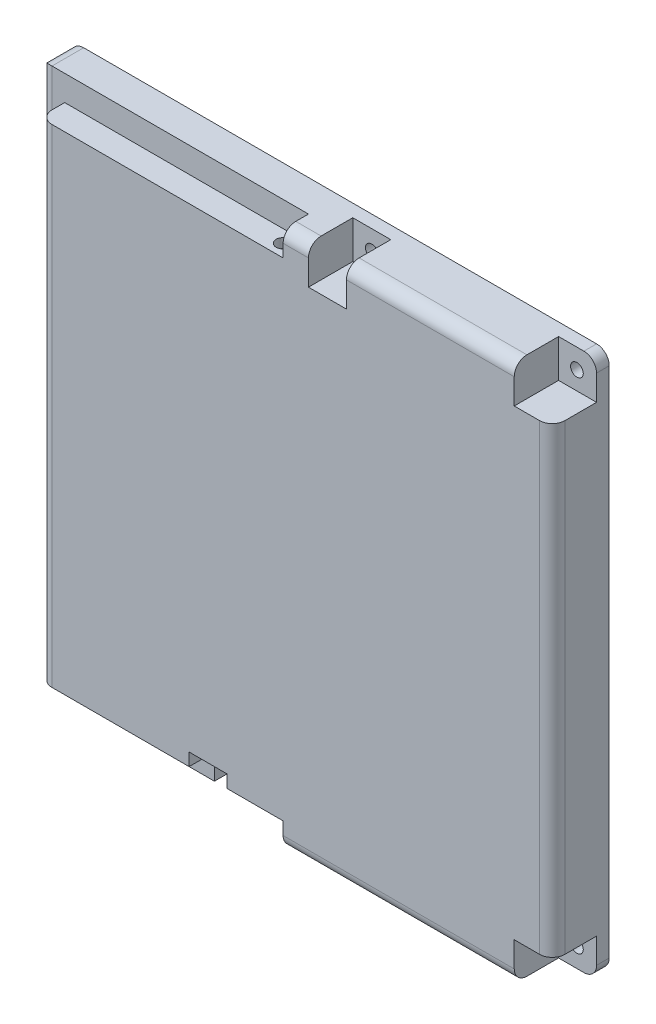
from build123d import *

# Parameters (mm, degrees)
EXTRUDE_1_DEPTH     = 9
CUT_EXTRUDE_2_DEPTH = 4
SKETCH_7_W          = 6
SKETCH_7_H          = 6
CUT_EXTRUDE_4_DEPTH = 7
SKETCH_10_W         = 6
SKETCH_10_H         = 6
CUT_EXTRUDE_6_DEPTH = 7
SHELL_1_T           = -1.5
SKETCH_5_R          = 1.1
CUT_EXTRUDE_3_DEPTH = 4
CUT_EXTRUDE_5_REACH = 179.286
CUT_EXTRUDE_START   = -7
SKETCH_6_R          = 1
FILLET_1_R          = 2
CUT_EXTRUDE_7_REACH = 172.192
SKETCH_12_R         = 1


with BuildPart() as part:
    # 草图1 → 凸台-拉伸1 (new body)
    with BuildSketch(Plane.XY):
        Polygon((70.444808084, 16.058078986), (70.444808084, -68.941921014), (155.445322416, -68.941921014), (155.444808084, 16.058078986), align=None)
    extrude(amount=EXTRUDE_1_DEPTH)

    # 草图4 → 支架切除-拉伸2 (cut)
    with BuildSketch(Plane.XY.offset(9)):
        Polygon((112.94506525, 16.058078986), (70.444808084, 16.058078986), (70.444808084, -68.941921014), (112.94506525, -68.941921014), (112.94506525, -64.941921014), (74.444808084, -64.941921014), (74.444808084, 12.058078986), (112.94506525, 12.058078986), align=None)
    extrude(amount=-CUT_EXTRUDE_2_DEPTH, mode=Mode.SUBTRACT)

    # 草图7 → 顶螺丝切除-拉伸4 (cut)
    with BuildSketch(Plane.XY.offset(9)):
        with Locations((152.445322416, 13.058078986)):
            Rectangle(SKETCH_7_W, SKETCH_7_H)
        with Locations((152.445322416, -65.941921014)):
            Rectangle(SKETCH_7_W, SKETCH_7_H)
    extrude(amount=-CUT_EXTRUDE_4_DEPTH, mode=Mode.SUBTRACT)

    # 草图10 → 底螺丝切除-拉伸6 (cut)
    with BuildSketch(Plane.XY.offset(9)):
        with Locations((119.944808084, 13.058078986)):
            Rectangle(SKETCH_10_W, SKETCH_10_H)
        with Locations((101.094808084, -65.941921014)):
            Rectangle(SKETCH_10_W, SKETCH_10_H)
    extrude(amount=-CUT_EXTRUDE_6_DEPTH, mode=Mode.SUBTRACT)

    # 抽壳1
    shell_1_openings = [part.faces().sort_by_distance(p)[0] for p in [
        (112.944936668, -26.441963874, 0),
    ]]
    offset(amount=SHELL_1_T, openings=shell_1_openings, kind=Kind.INTERSECTION)

    # 草图5 → 切除-拉伸3 (cut)
    with BuildSketch(Plane(origin=(0, 12.058078986, 0), x_dir=(1, 0, 0), z_dir=(0, 1, 0))):
        with Locations((110.94506525, -7)):
            Circle(SKETCH_5_R)
    cut_extrude_3 = extrude(amount=-CUT_EXTRUDE_3_DEPTH, mode=Mode.SUBTRACT)

    # 镜向1: 切除-拉伸3 across plane
    add(cut_extrude_3.mirror(Plane.ZX.offset(-26.441921014)), mode=Mode.SUBTRACT)

    # 草图6 → 顶螺丝切除-拉伸5 (cut, up to next)
    with BuildSketch(Plane.XY.offset(9).offset(CUT_EXTRUDE_START), mode=Mode.PRIVATE) as cut_extrude_5_sk1:
        with Locations((152.344808084, 12.958078986)):
            Circle(SKETCH_6_R)
    cut_extrude_5_tool1 = extrude(cut_extrude_5_sk1.sketch, amount=-CUT_EXTRUDE_5_REACH, mode=Mode.PRIVATE) & part.part
    # 草图6 → 顶螺丝切除-拉伸5 (cut, up to next)
    with BuildSketch(Plane.XY.offset(9).offset(CUT_EXTRUDE_START), mode=Mode.PRIVATE) as cut_extrude_5_sk2:
        with Locations((152.344808084, -65.841921014)):
            Circle(SKETCH_6_R)
    cut_extrude_5_tool2 = extrude(cut_extrude_5_sk2.sketch, amount=-CUT_EXTRUDE_5_REACH, mode=Mode.PRIVATE) & part.part
    add(cut_extrude_5_tool1.solids().sort_by_distance((152.344808, 12.958079, 2))[0], mode=Mode.SUBTRACT)
    add(cut_extrude_5_tool2.solids().sort_by_distance((152.344808, -65.841921, 2))[0], mode=Mode.SUBTRACT)

    # 圆角1
    fillet_1_edges = [part.edges().sort_by_distance(p)[0] for p in [
        (131.195193833, -68.941921014, 9),
        (114.944936667, 16.058078986, 9),
        (70.444808084, 16.058078986, 2.5),
        (70.444808084, -68.941921014, 2.5),
        (155.445322416, -68.941921014, 1),
        (155.444808084, 16.058078986, 1),
        (155.44506525, -26.441921014, 9),
        (74.444808084, -26.441921014, 9),
        (70.444808084, -26.441921014, 5),
        (136.19506525, 16.058078986, 9),
    ]]
    fillet(fillet_1_edges, radius=FILLET_1_R)

    # 草图12 → 底螺丝切除-拉伸7 (cut, up to next)
    with BuildSketch(Plane.XY.offset(2), mode=Mode.PRIVATE) as cut_extrude_7_sk1:
        with Locations((119.944808084, 12.958078986)):
            Circle(SKETCH_12_R)
    cut_extrude_7_tool1 = extrude(cut_extrude_7_sk1.sketch, amount=-CUT_EXTRUDE_7_REACH, mode=Mode.PRIVATE) & part.part
    # 草图12 → 底螺丝切除-拉伸7 (cut, up to next)
    with BuildSketch(Plane.XY.offset(2), mode=Mode.PRIVATE) as cut_extrude_7_sk2:
        with Locations((101.094808084, -65.841921014)):
            Circle(SKETCH_12_R)
    cut_extrude_7_tool2 = extrude(cut_extrude_7_sk2.sketch, amount=-CUT_EXTRUDE_7_REACH, mode=Mode.PRIVATE) & part.part
    add(cut_extrude_7_tool1.solids().sort_by_distance((119.944808, 12.958079, 2))[0], mode=Mode.SUBTRACT)
    add(cut_extrude_7_tool2.solids().sort_by_distance((101.094808, -65.841921, 2))[0], mode=Mode.SUBTRACT)


solid = part.part
